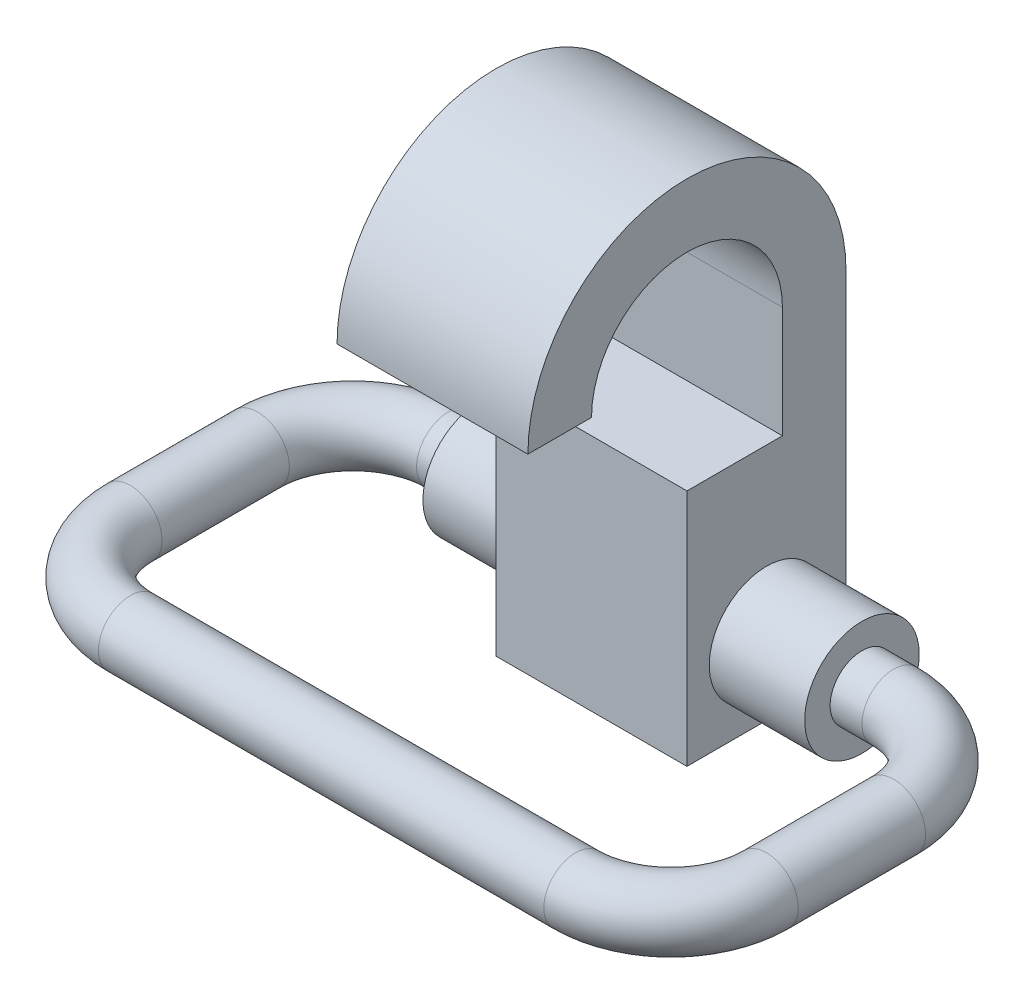
from build123d import *

# Parameters (mm, degrees)
ESBO_O1_R                 = 100
RESSALTO_EXTRUS_O2_DEPTH  = 700
ESBO_O1_9_R               = 180
ESBO_O1_9_R_2             = 100
RESSALTO_EXTRUS_O6_DEPTH  = 600
ESBO_O1_10_R              = 180
RESSALTO_EXTRUS_O7_DEPTH  = 300
ESBO_O3_W                 = 300
ESBO_O3_H                 = 200
RESSALTO_EXTRUS_O8_DEPTH  = 350
RESSALTO_EXTRUS_O9_DEPTH  = 300
ESBO_O9_R                 = 100
ESBO_O10_R                = 100
RESSALTO_EXTRUS_O10_DEPTH = 400
ESBO_O15_R                = 100
ESBO_O17_R                = 100
RESSALTO_EXTRUS_O11_DEPTH = 700
ESBO_O21_W                = 500
ESBO_O21_H                = 750
RESSALTO_EXTRUS_O12_DEPTH = 300
ESBO_O22_W                = 200
ESBO_O22_H                = 350
RESSALTO_EXTRUS_O13_DEPTH = 300


with BuildPart() as part:
    # Esboço1 → Ressalto-extrusão2 (new body)
    with BuildSketch(Plane(origin=(0, 0, 0), x_dir=(0, 0, -1), z_dir=(1, 0, 0))):
        with Locations((0, -135)):
            Circle(ESBO_O1_R)
    ressalto_extrus_o2 = extrude(amount=RESSALTO_EXTRUS_O2_DEPTH)

    # Esboço1<9> → Ressalto-extrusão6 (add)
    with BuildSketch(Plane(origin=(0, 0, 0), x_dir=(0, 0, -1), z_dir=(1, 0, 0))):
        with Locations((0, -135)):
            Circle(ESBO_O1_9_R)
        with Locations((0, -135)):
            Circle(ESBO_O1_9_R_2, mode=Mode.SUBTRACT)
    ressalto_extrus_o6 = extrude(amount=RESSALTO_EXTRUS_O6_DEPTH)

    # Esboço1<10> → Ressalto-extrusão7 (add)
    with BuildSketch(Plane(origin=(0, 0, 0), x_dir=(0, 0, -1), z_dir=(1, 0, 0))):
        Polygon((-250, 375), (-250, -375), (250, -375), (250, 375), (50, 375), align=None)
        with Locations((0, -135)):
            Circle(ESBO_O1_10_R, mode=Mode.SUBTRACT)
    extrude(amount=RESSALTO_EXTRUS_O7_DEPTH)

    # Esboço3 → Ressalto-extrusão8 (add)
    with BuildSketch(Plane(origin=(0, 375, 0), x_dir=(1, 0, 0), z_dir=(0, 1, 0))):
        with Locations((150, 150)):
            Rectangle(ESBO_O3_W, ESBO_O3_H)
    extrude(amount=RESSALTO_EXTRUS_O8_DEPTH)

    # Esboço5 → Ressalto-extrusão9 (add)
    with BuildSketch(Plane(origin=(300, 0, 0), x_dir=(0, 0, -1), z_dir=(1, 0, 0))):
        with BuildLine():
            Line((-750, 725), (-550, 725))
            ThreePointArc((-550, 725), (-250, 1025), (50, 725))
            Line((50, 725), (250, 725))
            ThreePointArc((250, 725), (-250, 1225), (-750, 725))
        make_face()
    ressalto_extrus_o9 = extrude(amount=-RESSALTO_EXTRUS_O9_DEPTH)

    # Varredura1: sweep along a path in Esboço8
    with BuildLine(Plane(origin=(0, -135, 0), x_dir=(-1, 0, 0), z_dir=(0, -1, 0))) as varredura1_path:
        ThreePointArc((-700, 0), (-912.132034356, -87.867965644), (-1000, -300))
    # Esboço9 → Varredura1 (sweep)
    with BuildSketch(Plane(origin=(700, 0, 0), x_dir=(0, 0, -1), z_dir=(1, 0, 0))):
        with Locations((0, -135)):
            Circle(ESBO_O9_R)
    varredura1 = sweep(path=varredura1_path.line)

    # Esboço10 → Ressalto-extrusão10 (add)
    with BuildSketch(Plane.XY.offset(300)):
        with Locations((1000, -135)):
            Circle(ESBO_O10_R)
    ressalto_extrus_o10 = extrude(amount=RESSALTO_EXTRUS_O10_DEPTH)

    # Varredura2: sweep along a path in Esboço14
    with BuildLine(Plane(origin=(0, -135, 0), x_dir=(-1, 0, 0), z_dir=(0, -1, 0))) as varredura2_path:
        ThreePointArc((-1000, -700), (-912.132034356, -912.132034356), (-700, -1000))
    # Esboço15 → Varredura2 (sweep)
    with BuildSketch(Plane.XY.offset(700)):
        with Locations((1000, -135)):
            Circle(ESBO_O15_R)
    varredura2 = sweep(path=varredura2_path.line)

    # Esboço17 → Ressalto-extrusão11 (add)
    with BuildSketch(Plane.ZY.offset(-700)):
        with Locations((1000, -135)):
            Circle(ESBO_O17_R)
    ressalto_extrus_o11 = extrude(amount=RESSALTO_EXTRUS_O11_DEPTH)

    # Espelhar1: Ressalto-extrusão11 across Right Plane
    add(ressalto_extrus_o11.mirror(Plane(origin=(0, 0, 0), x_dir=(0, 0, -1), z_dir=(1, 0, 0))))

    # Espelhar2: Varredura2 across Right Plane
    add(varredura2.mirror(Plane(origin=(0, 0, 0), x_dir=(0, 0, -1), z_dir=(1, 0, 0))))

    # Espelhar3: Ressalto-extrusão10 across Right Plane
    add(ressalto_extrus_o10.mirror(Plane(origin=(0, 0, 0), x_dir=(0, 0, -1), z_dir=(1, 0, 0))))

    # Espelhar4: Varredura1 across Right Plane
    add(varredura1.mirror(Plane(origin=(0, 0, 0), x_dir=(0, 0, -1), z_dir=(1, 0, 0))))

    # Espelhar5: Ressalto-extrusão2 across Right Plane
    add(ressalto_extrus_o2.mirror(Plane(origin=(0, 0, 0), x_dir=(0, 0, -1), z_dir=(1, 0, 0))))

    # Espelhar6: Ressalto-extrusão6 across Right Plane
    add(ressalto_extrus_o6.mirror(Plane(origin=(0, 0, 0), x_dir=(0, 0, -1), z_dir=(1, 0, 0))))

    # Espelhar7: Ressalto-extrusão9 across Right Plane
    add(ressalto_extrus_o9.mirror(Plane(origin=(0, 0, 0), x_dir=(0, 0, -1), z_dir=(1, 0, 0))))

    # Espelhar8: Ressalto-extrusão2 across plane
    add(ressalto_extrus_o2.mirror(Plane(origin=(300, 0, 0), x_dir=(0, 0, 1), z_dir=(1, 0, 0))))

    # Esboço21 → Ressalto-extrusão12 (add)
    with BuildSketch(Plane.ZY):
        Rectangle(ESBO_O21_W, ESBO_O21_H)
    extrude(amount=RESSALTO_EXTRUS_O12_DEPTH)

    # Esboço22 → Ressalto-extrusão13 (add)
    with BuildSketch(Plane.ZY):
        with Locations((-150, 550)):
            Rectangle(ESBO_O22_W, ESBO_O22_H)
    extrude(amount=RESSALTO_EXTRUS_O13_DEPTH)


solid = part.part
